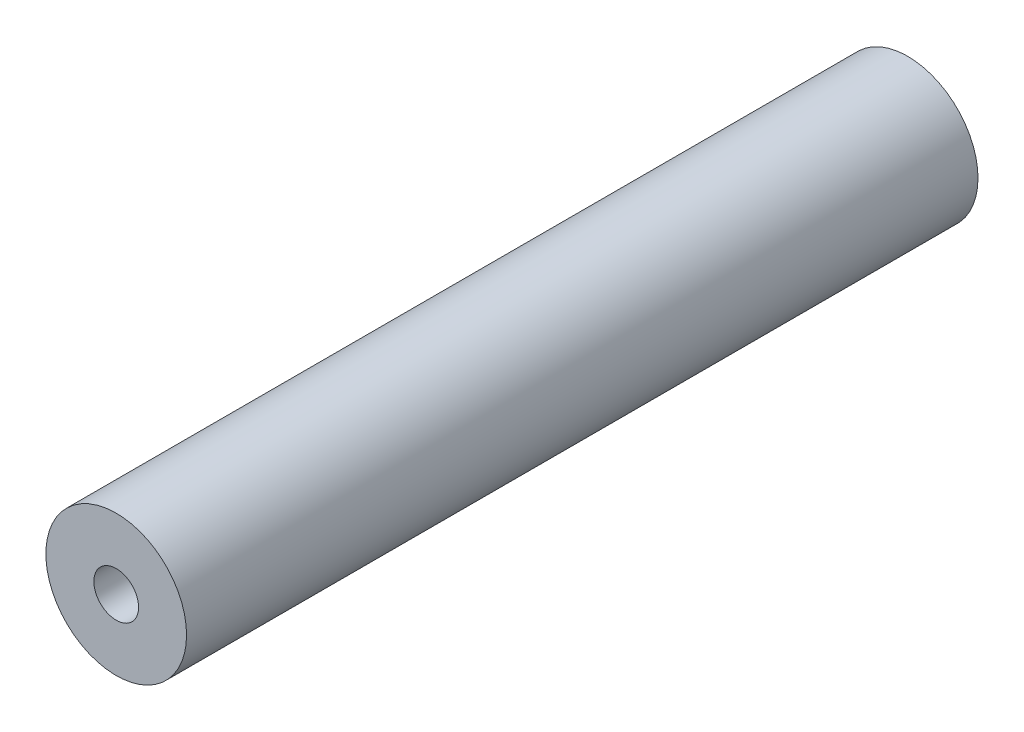
from build123d import *

# Parameters (mm, degrees)
SKETCH1_R                        = 6.35
SKETCH1_R_2                      = 2.0193
BOSS_EXTRUDE1_DEPTH              = 71.4375
F_10_32_TAPPED_HOLE1_D           = 4.0386
F_10_32_TAPPED_HOLE1_ON_FACE_2_D = 4.0386


with BuildPart() as part:
    # Sketch1 → Boss-Extrude1 (new body)
    with BuildSketch(Plane.XY):
        Circle(SKETCH1_R)
        Circle(SKETCH1_R_2, mode=Mode.SUBTRACT)
    extrude(amount=BOSS_EXTRUDE1_DEPTH)

    # #10-32 Tapped Hole1 (through all)
    with Locations(Plane.XY.offset(71.4375)):
        with Locations((0, 0)):
            Hole(F_10_32_TAPPED_HOLE1_D / 2)

    # #10-32 Tapped Hole1 on face 2 (through all)
    with Locations(Plane.XY):
        with Locations((0, 0)):
            Hole(F_10_32_TAPPED_HOLE1_ON_FACE_2_D / 2)


solid = part.part
